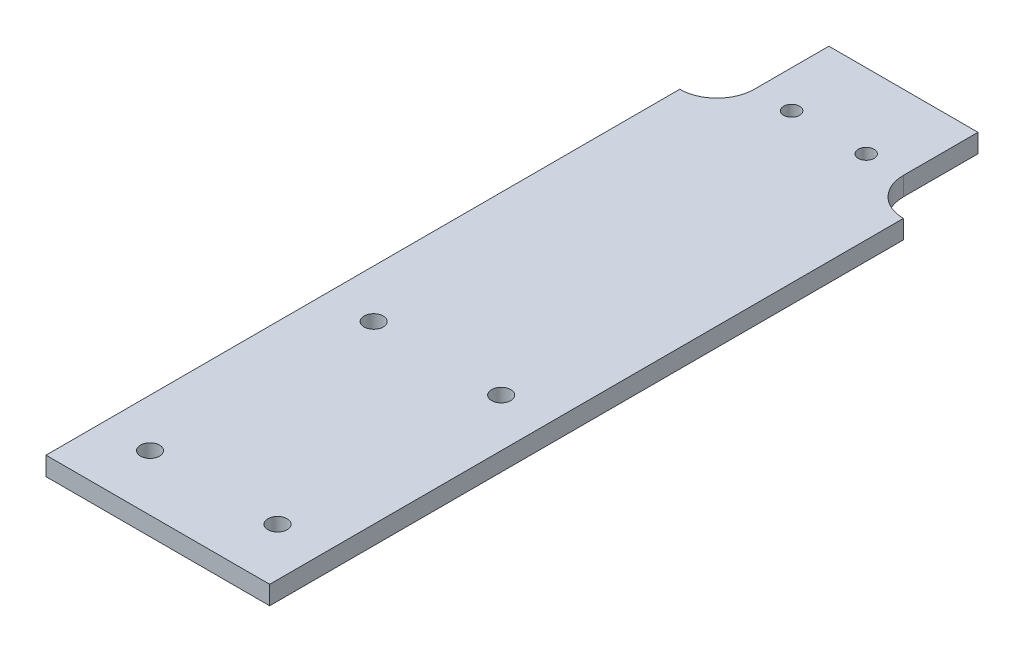
from build123d import *

# Parameters (mm, degrees)
SKETCH1_W                  = 38.1
SKETCH1_H                  = 127
EXTRUDE1_DEPTH             = 3.175
F_4_CLEARANCE_HOLE1_D      = 3.2639
F_4_CLEARANCE_HOLE1_DEPTH  = 101.6
F_4_CLEARANCE_HOLE1_TIP    = 0.980574487
SKETCH4_W                  = 6.35
SKETCH4_H                  = 19.05
CUT_EXTRUDE1_DEPTH         = 79.60930686
TAP_DRILL_FOR_6_TAP1_D     = 2.7051
TAP_DRILL_FOR_6_TAP1_DEPTH = 3.302
TAP_DRILL_FOR_6_TAP1_TIP   = 0.81269403
FILLET1_R                  = 6.35


with BuildPart() as part:
    # Sketch1 → Extrude1 (new body)
    with BuildSketch(Plane(origin=(0, 0, 0), x_dir=(1, 0, 0), z_dir=(0, 1, 0))):
        with Locations((0, -12.7)):
            Rectangle(SKETCH1_W, SKETCH1_H)
    extrude(amount=EXTRUDE1_DEPTH)

    # #4 Clearance Hole1
    with Locations(Plane(origin=(-10.8585, 0, 28.575), x_dir=(0, 0, -1), z_dir=(0, -1, 0))):
        with Locations((0, 0), (0, 21.717), (-38.1, 0), (-38.1, 21.717)):
            Hole(F_4_CLEARANCE_HOLE1_D / 2, depth=F_4_CLEARANCE_HOLE1_DEPTH)
            with Locations((0, 0, -(F_4_CLEARANCE_HOLE1_DEPTH + F_4_CLEARANCE_HOLE1_TIP / 2))):  # 118° drill point
                Cone(0, F_4_CLEARANCE_HOLE1_D / 2, F_4_CLEARANCE_HOLE1_TIP, mode=Mode.SUBTRACT)

    # Sketch4 → Cut-Extrude1 (cut, through all)
    with BuildSketch(Plane.XZ):
        with Locations((-15.875, -41.275)):
            Rectangle(SKETCH4_W, SKETCH4_H)
        with Locations((15.875, -41.275)):
            Rectangle(SKETCH4_W, SKETCH4_H)
    extrude(amount=-CUT_EXTRUDE1_DEPTH, mode=Mode.SUBTRACT)

    # Tap Drill for #6 Tap1
    with Locations(Plane(origin=(-6.35, 3.175, -38.1), x_dir=(0, 0, 1), z_dir=(0, 1, 0))):
        with Locations((0, 0), (0, 12.7)):
            Hole(TAP_DRILL_FOR_6_TAP1_D / 2, depth=TAP_DRILL_FOR_6_TAP1_DEPTH)
            with Locations((0, 0, -(TAP_DRILL_FOR_6_TAP1_DEPTH + TAP_DRILL_FOR_6_TAP1_TIP / 2))):  # 118° drill point
                Cone(0, TAP_DRILL_FOR_6_TAP1_D / 2, TAP_DRILL_FOR_6_TAP1_TIP, mode=Mode.SUBTRACT)

    # Fillet1
    fillet1_edges = [part.edges().sort_by_distance(p)[0] for p in [
        (-12.7, 1.5875, -31.75),
        (12.7, 1.5875, -31.75),
    ]]
    fillet(fillet1_edges, radius=FILLET1_R - 0.0001)  # a hair under: the kernel refuses the full size


solid = part.part
